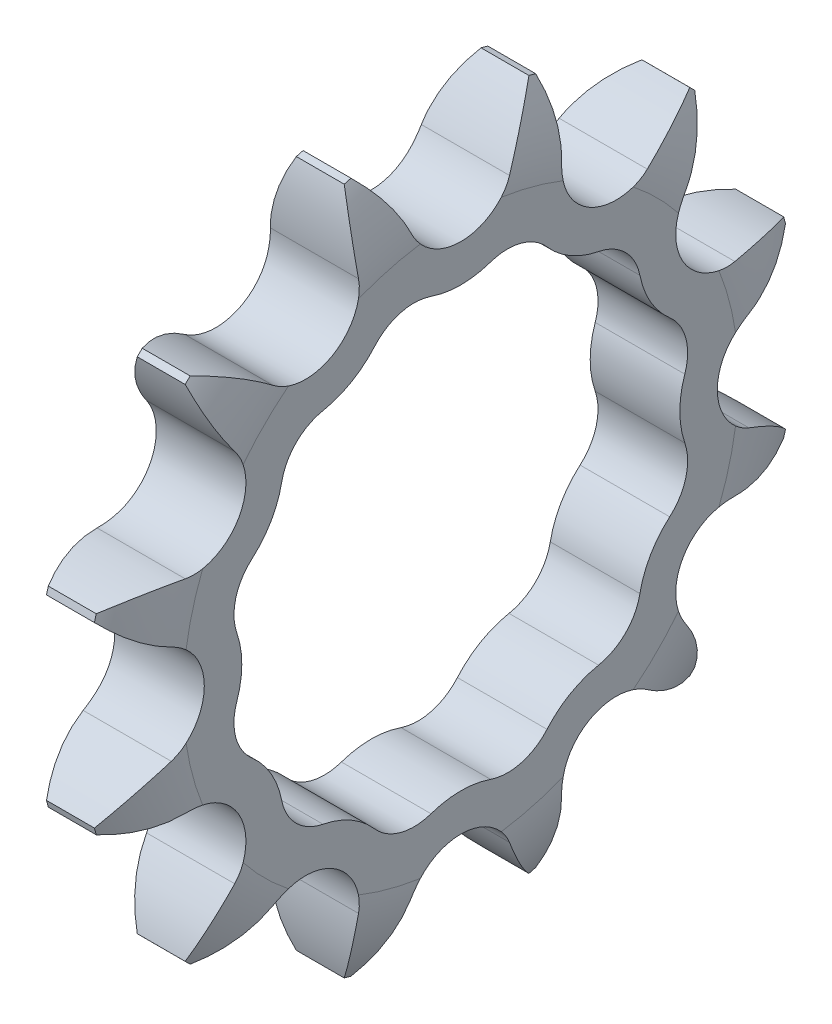
from build123d import *

# Parameters (mm, degrees)
TOOTHCUT_DEPTH     = 31.42037547
TEETHCUTS_COUNT    = 12
TEETHCUTS_ANGLE    = 330
BORSKE_R           = 13
BORE_DEPTH         = 50.0005
CUT_EXTRUDE1_DEPTH = 10
CIRPATTERN1_COUNT  = 12


with BuildPart() as part:
    # BasProSke → Base-Revolve (revolve)
    with BuildSketch(Plane(origin=(0, 0, 0), x_dir=(1, 0, 0), z_dir=(0, 1, 0))):
        with BuildLine():
            Line((0, 0), (0, 16.483135522))
            ThreePointArc((0, 16.483135522), (0.314698702, 18.911298408), (1.238, 21.179012011))
            Line((1.238, 21.179012011), (4.0816, 21.179012011))
            ThreePointArc((4.0816, 21.179012011), (5.004901298, 18.911298408), (5.3196, 16.483135522))
            Line((5.3196, 16.483135522), (5.3196, 0))
            Line((5.3196, 0), (0, 0))
        make_face()
    revolve(axis=Axis((-10, 0, 0), (1, 0, 0)))

    # TooCutSke → ToothCut (cut, through all)
    with BuildSketch(Plane(origin=(0, 0, 0), x_dir=(0, 0, -1), z_dir=(1, 0, 0))):
        with BuildLine():
            ThreePointArc((2.935175086, 17.141129064), (4.117287884, 19.180881652), (5.718542834, 20.911189102))
            ThreePointArc((5.718542834, 20.911189102), (0, 21.679012011), (-5.718542834, 20.911189102))
            ThreePointArc((-5.718542834, 20.911189102), (-4.117287884, 19.180881652), (-2.935175086, 17.141129064))
            ThreePointArc((-2.935175086, 17.141129064), (0, 15.225887011), (2.935175086, 17.141129064))
        make_face()
    toothcut = extrude(amount=TOOTHCUT_DEPTH, mode=Mode.SUBTRACT)

    # TeethCuts: ToothCut ×12 about axis
    teethcuts_axis = Axis((-10, 0, 0), (1, 0, 0))
    for i in range(1, TEETHCUTS_COUNT):
        add(toothcut.rotate(teethcuts_axis, i * TEETHCUTS_ANGLE / (TEETHCUTS_COUNT - 1)), mode=Mode.SUBTRACT)

    # BorSke → Bore (cut, symmetric)
    with BuildSketch(Plane(origin=(0, 0, 0), x_dir=(0, 0, -1), z_dir=(1, 0, 0))):
        Circle(BORSKE_R)
    extrude(amount=BORE_DEPTH, both=True, mode=Mode.SUBTRACT)

    # Sketch1 → Cut-Extrude1 (cut)
    with BuildSketch(Plane(origin=(5.3196, 0, 0), x_dir=(0, 0, -1), z_dir=(1, 0, 0))):
        with BuildLine():
            Line((-9.779449322, 9.779449322), (0, 0))
            Line((0, 0), (-13.358976208, 3.579526887))
            ThreePointArc((-13.358976208, 3.579526887), (-12.993633332, 4.419812593), (-12.39861156, 5.116594178))
            ThreePointArc((-12.39861156, 5.116594178), (-11.258330249, 6.5), (-10.630406319, 8.179215494))
            ThreePointArc((-10.630406319, 8.179215494), (-10.324486652, 9.042910257), (-9.779449322, 9.779449322))
        make_face()
    cut_extrude1 = extrude(amount=-CUT_EXTRUDE1_DEPTH, mode=Mode.SUBTRACT)

    # CirPattern1: Cut-Extrude1 ×12 about axis
    cirpattern1_axis = Axis((50.0005, 0, 0), (-1, 0, 0))
    for i in range(1, CIRPATTERN1_COUNT):
        add(cut_extrude1.rotate(cirpattern1_axis, i * 360 / CIRPATTERN1_COUNT), mode=Mode.SUBTRACT)


solid = part.part
